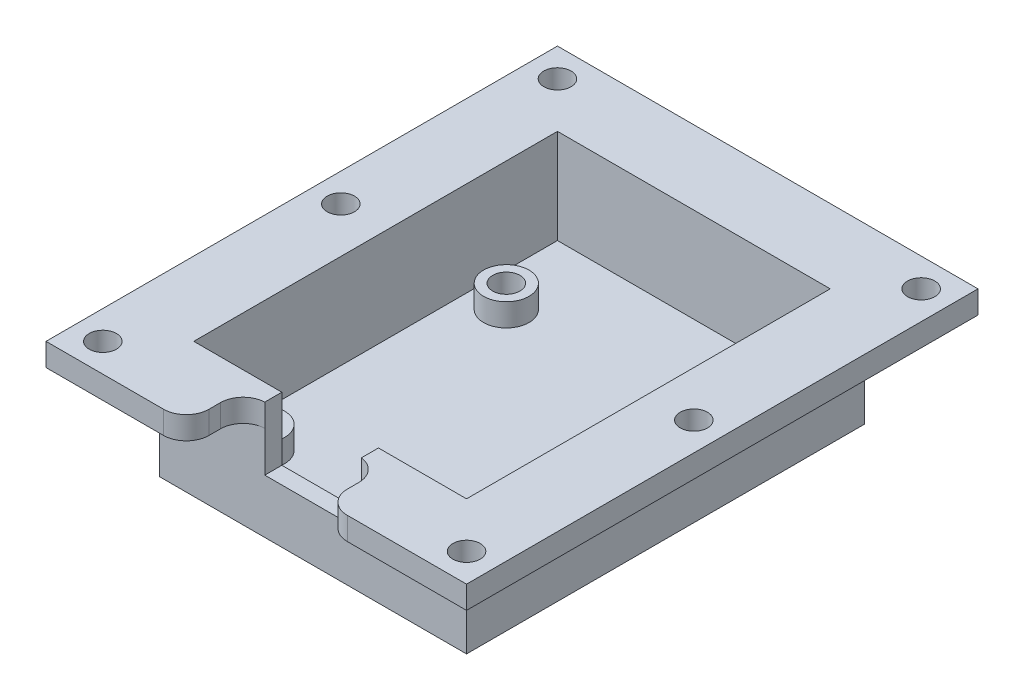
from build123d import *

# Parameters (mm, degrees)
SKETCH1_W                      = 27
SKETCH1_H                      = 35
SKETCH1_R                      = 1.113712744
SKETCH1_R_2                    = 1.000106258
SKETCH1_R_3                    = 1.174626552
SKETCH1_R_4                    = 1.19920455
SKETCH1_W_2                    = 8.5
SKETCH1_H_2                    = 2.12
BOSS_EXTRUDE1_DEPTH            = 2
SKETCH3_R                      = 2
BOSS_EXTRUDE2_DEPTH            = 2
M2_CLEARANCE_HOLE1_D           = 2.4
LPATTERN1_COUNT                = 2
LPATTERN1_PITCH                = 18
LPATTERN1_COUNT_DIR2           = 2
LPATTERN1_PITCH_DIR2           = 21.5
SKETCH6_W                      = 27
SKETCH6_H                      = 35
SKETCH6_W_2                    = 24
SKETCH6_H_2                    = 32
BOSS_EXTRUDE4_DEPTH            = 8.32
CUT_EXTRUDE1_REACH             = 41.261
SKETCH7_W                      = 8.5
SKETCH7_H                      = 5.57
CUT_EXTRUDE1_DIRECTION_2_DEPTH = 40.260756636
BOSS_EXTRUDE5_START            = -4
BOSS_EXTRUDE5_OUTLINE_R        = 1.2
BOSS_EXTRUDE5_DEPTH            = 2
M2_CLEARANCE_HOLE2_D           = 2.4
FILLET1_R                      = 2


with BuildPart() as part:
    # Sketch1 → Boss-Extrude1 (new body)
    # profile 1 of 8: a face of its own
    with BuildSketch(Plane(origin=(0, 0, 0), x_dir=(1, 0, 0), z_dir=(0, 1, 0))):
        with Locations((0.988085162, -0.939800033)):
            Rectangle(SKETCH1_W, SKETCH1_H)
        Polygon((-10.011914838, -15.939800033), (-10.011914838, 14.060199967), (11.988085162, 14.060199967), (11.988085162, -15.939800033), (5.238085162, -15.939800033), (5.238085162, -18.059800033), (-3.261914838, -18.059800033), (-3.261914838, -15.939800033), align=None, mode=Mode.SUBTRACT)
    # profile 2 of 8: a face of its own
    with BuildSketch(Plane(origin=(0, 0, 0), x_dir=(1, 0, 0), z_dir=(0, 1, 0))):
        Polygon((11.988085162, 14.060199967), (-10.011914838, 14.060199967), (-10.011914838, -15.939800033), (-3.261914838, -15.939800033), (-3.261914838, -13.819800033), (5.238085162, -13.819800033), (5.238085162, -15.939800033), (11.988085162, -15.939800033), align=None)
        with Locations((-8.011914838, -13.939800033)):
            Circle(SKETCH1_R, mode=Mode.SUBTRACT)
        with Locations((7.931487186, -14.291814947)):
            Circle(SKETCH1_R_2, mode=Mode.SUBTRACT)
        with Locations((-8.011914838, 7.560199967)):
            Circle(SKETCH1_R_3, mode=Mode.SUBTRACT)
        with Locations((9.988085162, 7.560199967)):
            Circle(SKETCH1_R_4, mode=Mode.SUBTRACT)
    # profile 3 of 8: a face of its own
    with BuildSketch(Plane(origin=(0, 0, 0), x_dir=(1, 0, 0), z_dir=(0, 1, 0))):
        with Locations((-8.011914838, 7.560199967)):
            Circle(SKETCH1_R_3)
    # profile 4 of 8: a face of its own
    with BuildSketch(Plane(origin=(0, 0, 0), x_dir=(1, 0, 0), z_dir=(0, 1, 0))):
        with Locations((9.988085162, 7.560199967)):
            Circle(SKETCH1_R_4)
    # profile 5 of 8: a face of its own
    with BuildSketch(Plane(origin=(0, 0, 0), x_dir=(1, 0, 0), z_dir=(0, 1, 0))):
        with Locations((7.931487186, -14.291814947)):
            Circle(SKETCH1_R_2)
    # profile 6 of 8: a face of its own
    with BuildSketch(Plane(origin=(0, 0, 0), x_dir=(1, 0, 0), z_dir=(0, 1, 0))):
        with Locations((0.988085162, -16.999800033)):
            Rectangle(SKETCH1_W_2, SKETCH1_H_2)
    # profile 7 of 8: a face of its own
    with BuildSketch(Plane(origin=(0, 0, 0), x_dir=(1, 0, 0), z_dir=(0, 1, 0))):
        with Locations((0.988085162, -14.879800033)):
            Rectangle(SKETCH1_W_2, SKETCH1_H_2)
    # profile 8 of 8: a face of its own
    with BuildSketch(Plane(origin=(0, 0, 0), x_dir=(1, 0, 0), z_dir=(0, 1, 0))):
        with Locations((-8.011914838, -13.939800033)):
            Circle(SKETCH1_R)
    extrude(amount=BOSS_EXTRUDE1_DEPTH)

    # Sketch3 → Boss-Extrude2 (add)
    with BuildSketch(Plane(origin=(0, 2, 0), x_dir=(1, 0, 0), z_dir=(0, 1, 0))):
        with Locations(Location((-8.011914838, 7.560199967, 0), (0, 0, 270))):
            Circle(SKETCH3_R)
    boss_extrude2 = extrude(amount=BOSS_EXTRUDE2_DEPTH)

    # M2 Clearance Hole1 (through all)
    with Locations(Plane(origin=(0, 4, 0), x_dir=(1, 0, 0), z_dir=(0, 1, 0))):
        with Locations((-8.011914838, 7.560199967)):
            m2_clearance_hole1 = Hole(M2_CLEARANCE_HOLE1_D / 2)

    # LPattern1: Boss-Extrude2, M2 Clearance Hole1 2 × 2
    with Locations(*[(i * LPATTERN1_PITCH, 0, j * LPATTERN1_PITCH_DIR2) for i in range(LPATTERN1_COUNT) for j in range(LPATTERN1_COUNT_DIR2) if (i, j) != (0, 0)]):
        add(boss_extrude2)
        add(m2_clearance_hole1, mode=Mode.SUBTRACT)

    # Sketch6 → Boss-Extrude4 (add)
    with BuildSketch(Plane(origin=(0, 2, 0), x_dir=(1, 0, 0), z_dir=(0, 1, 0))):
        with Locations((0.988085162, -0.939800033)):
            Rectangle(SKETCH6_W, SKETCH6_H)
        with Locations((0.988085162, -0.939800033)):
            Rectangle(SKETCH6_W_2, SKETCH6_H_2, mode=Mode.SUBTRACT)
    extrude(amount=BOSS_EXTRUDE4_DEPTH)

    # Sketch7 → Cut-Extrude1 (cut, up to next)
    with BuildSketch(Plane.XY.offset(18.439800033), mode=Mode.PRIVATE) as cut_extrude1_sk1:
        with Locations((0.988085162, 7.535)):
            Rectangle(SKETCH7_W, SKETCH7_H)
    cut_extrude1_tool1 = extrude(cut_extrude1_sk1.sketch, amount=-CUT_EXTRUDE1_REACH, mode=Mode.PRIVATE) & part.part
    add(cut_extrude1_tool1.solids().sort_by_distance((0.988085, 7.535, 18.4398))[0], mode=Mode.SUBTRACT)

    # Sketch7 → Cut-Extrude1 direction 2 (cut)
    with BuildSketch(Plane.XY.offset(18.439800033)):
        with Locations((0.988085162, 7.535)):
            Rectangle(SKETCH7_W, SKETCH7_H)
    extrude(amount=CUT_EXTRUDE1_DIRECTION_2_DEPTH, mode=Mode.SUBTRACT)

    # Boss-Extrude5: read off the stored shape, not the designer's step
    # Boss-Extrude5 outline → Boss-Extrude5 (add)
    with BuildSketch(Plane(origin=(0, 12.32, 0), x_dir=(1, 0, 0), z_dir=(0, 1, 0)).offset(BOSS_EXTRUDE5_START)):
        Polygon((-5.169409796, -23.439799853), (-5.169409796, -18.439799853), (-12.511914838, -18.439800033), (-12.511914838, 16.560199967), (14.488085162, 16.560199967), (14.488085162, -18.439800033), (7.002600417, -18.439800033), (7.002600417, -23.439799853), (19.488084722, -23.439799853), (19.488084722, 21.560200147), (-17.511915278, 21.560200147), (-17.511915278, -23.439799853), align=None)
        with Locations((-15.011915278, -20.939799853)):
            Circle(BOSS_EXTRUDE5_OUTLINE_R, mode=Mode.SUBTRACT)
        with Locations((16.988084722, -20.939799853)):
            Circle(BOSS_EXTRUDE5_OUTLINE_R, mode=Mode.SUBTRACT)
        with Locations((-15.011915278, 0)):
            Circle(BOSS_EXTRUDE5_OUTLINE_R, mode=Mode.SUBTRACT)
        with Locations((-15.011915278, 19.060200147)):
            Circle(BOSS_EXTRUDE5_OUTLINE_R, mode=Mode.SUBTRACT)
        with Locations((16.988084722, -0.939799853)):
            Circle(BOSS_EXTRUDE5_OUTLINE_R, mode=Mode.SUBTRACT)
        with Locations((16.988084722, 19.060200147)):
            Circle(BOSS_EXTRUDE5_OUTLINE_R, mode=Mode.SUBTRACT)
    extrude(amount=BOSS_EXTRUDE5_DEPTH)

    # M2 Clearance Hole2 (through all)
    with Locations(Plane(origin=(0, 10.32, 0), x_dir=(1, 0, 0), z_dir=(0, 1, 0))):
        with Locations((-15.011915278, 19.060200147), (-15.011915278, 0), (-15.011915278, -20.939799853), (16.988084722, -20.939799853), (16.988084722, -0.939799853), (16.988084722, 19.060200147)):
            Hole(M2_CLEARANCE_HOLE2_D / 2)

    # Fillet1
    # the kernel refuses this fillet: 2 mm, written as the material it adds along each edge
    with BuildSketch(Plane(origin=(7.002600417, 8.32, 18.439800033), x_dir=(0, 0, 1), z_dir=(0, 1, 0))) as fillet1_piece_1:
        with BuildLine():
            CenterArc((1.98608835, -2), FILLET1_R, 90, 83.23817367)
            Line((0, -1.764515255), (-0.039721767, -1.75980556))
            ThreePointArc((-0.039721767, -1.75980556), (-0.04, -0.882257627), (-0.04, 0))
            Line((-0.04, 0), (0, 0.04))
            Line((0, 0.04), (1.98608835, 0.04))
            Line((1.98608835, 0.04), (1.98608835, 0))
        make_face()
    extrude(amount=2)
    # the kernel refuses this fillet: 2 mm, written as the material it adds along each edge
    with BuildSketch(Plane(origin=(-5.169409796, 8.32, 18.439799853), x_dir=(0, 0, 1), z_dir=(0, 1, 0))) as fillet1_2_piece_1:
        with BuildLine():
            CenterArc((1.997859739, 2), FILLET1_R, 182.651020031, 87.348979969)
            Line((1.8e-07, 1.907494958), (-0.039957011, 1.905644857))
            ThreePointArc((-0.039957011, 1.905644857), (-0.03999982, 0.953747479), (-0.04, 0))
            Line((-0.04, 0), (0, -0.04))
            Line((0, -0.04), (1.997859739, -0.04))
            Line((1.997859739, -0.04), (1.997859739, 0))
        make_face()
    extrude(amount=2)
    # the kernel refuses this fillet: 2 mm, written as the material it takes off along each edge
    with BuildSketch(Plane(origin=(-5.169409796, 3.32, 23.439799853), x_dir=(0, 0, -1), z_dir=(0, 1, 0))) as fillet1_3_piece_1:
        with BuildLine():
            CenterArc((FILLET1_R, FILLET1_R), FILLET1_R, 180, 90)
            Line((0, FILLET1_R), (-FILLET1_R * 0.02, FILLET1_R))
            Line((-FILLET1_R * 0.02, FILLET1_R), (-FILLET1_R * 0.02, -FILLET1_R * 0.02))
            Line((-FILLET1_R * 0.02, -FILLET1_R * 0.02), (FILLET1_R, -FILLET1_R * 0.02))
            Line((FILLET1_R, -FILLET1_R * 0.02), (FILLET1_R, 0))
        make_face()
    extrude(amount=12, mode=Mode.SUBTRACT)
    # the kernel refuses this fillet: 2 mm, written as the material it takes off along each edge
    with BuildSketch(Plane(origin=(7.002600417, 3.32, 23.439799853), x_dir=(1, 0, 0), z_dir=(0, 1, 0))) as fillet1_4_piece_1:
        with BuildLine():
            CenterArc((FILLET1_R, FILLET1_R), FILLET1_R, 180, 90)
            Line((0, FILLET1_R), (-FILLET1_R * 0.02, FILLET1_R))
            Line((-FILLET1_R * 0.02, FILLET1_R), (-FILLET1_R * 0.02, -FILLET1_R * 0.02))
            Line((-FILLET1_R * 0.02, -FILLET1_R * 0.02), (FILLET1_R, -FILLET1_R * 0.02))
            Line((FILLET1_R, -FILLET1_R * 0.02), (FILLET1_R, 0))
        make_face()
    extrude(amount=12, mode=Mode.SUBTRACT)


solid = part.part
